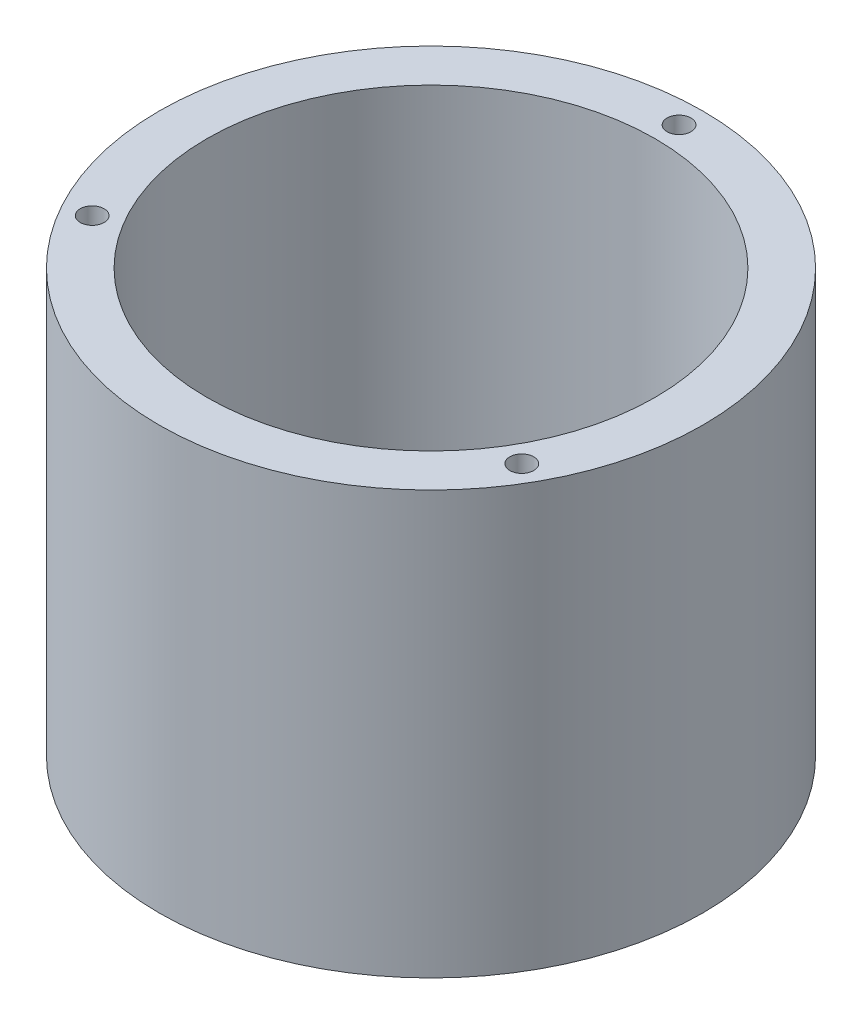
from build123d import *

# Parameters (mm, degrees)
SKETCH1_R           = 45.5
SKETCH1_R_2         = 33.5
BOSS_EXTRUDE1_DEPTH = 4
SKETCH2_R           = 45.5
SKETCH2_R_2         = 37.5
BOSS_EXTRUDE2_DEPTH = 66.7
SKETCH4_R           = 2
CUT_EXTRUDE1_DEPTH  = 6
CIRPATTERN1_COUNT   = 3


with BuildPart() as part:
    # Sketch1 → Boss-Extrude1 (new body)
    with BuildSketch(Plane(origin=(0, 0, 0), x_dir=(1, 0, 0), z_dir=(0, 1, 0))):
        Circle(SKETCH1_R)
        Circle(SKETCH1_R_2, mode=Mode.SUBTRACT)
    extrude(amount=BOSS_EXTRUDE1_DEPTH)

    # Sketch2 → Boss-Extrude2 (add)
    with BuildSketch(Plane(origin=(0, 4, 0), x_dir=(1, 0, 0), z_dir=(0, 1, 0))):
        Circle(SKETCH2_R)
        Circle(SKETCH2_R_2, mode=Mode.SUBTRACT)
    extrude(amount=BOSS_EXTRUDE2_DEPTH)

    # Sketch4 → Cut-Extrude1 (cut)
    with BuildSketch(Plane(origin=(0, 70.7, 0), x_dir=(1, 0, 0), z_dir=(0, 1, 0))):
        with Locations((0, 41.5)):
            Circle(SKETCH4_R)
    cut_extrude1 = extrude(amount=-CUT_EXTRUDE1_DEPTH, mode=Mode.SUBTRACT)

    # CirPattern1: Cut-Extrude1 ×3 about axis
    cirpattern1_axis = Axis((0, 70.7, 0), (0, 1, 0))
    for i in range(1, CIRPATTERN1_COUNT):
        add(cut_extrude1.rotate(cirpattern1_axis, i * 360 / CIRPATTERN1_COUNT), mode=Mode.SUBTRACT)


solid = part.part
